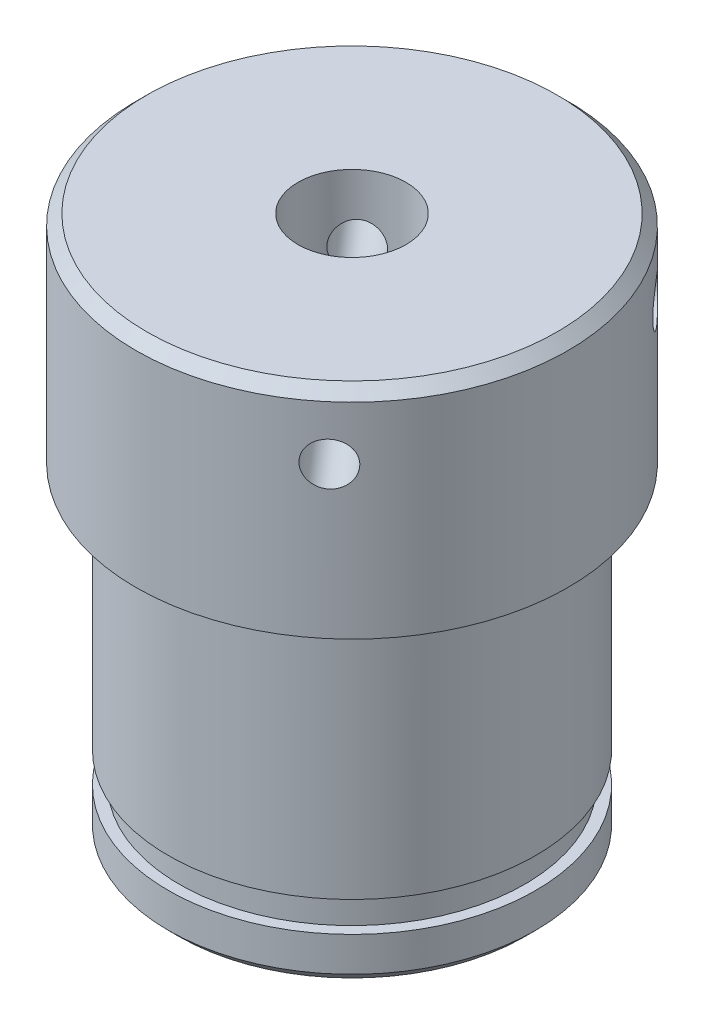
from build123d import *

# Parameters (mm, degrees)
SKETCH_1_R               = 8.5
EXTRUDE_1_DEPTH          = 15
SKETCH_2_R               = 10
EXTRUDE_2_DEPTH          = 10
SKETCH_3_R               = 1
CUT_EXTRUDE_1_DEPTH      = 10
CUT_EXTRUDE_START        = -2.1
SKETCH_4_R               = 8.5
SKETCH_4_R_2             = 8
CUT_EXTRUDE_2_DEPTH      = 1.4
CHAMFER_1_SIZE           = 0.5
SKETCH_7_R               = 1
CUT_EXTRUDE_3_DEPTH      = 8
PATTERN_CIRCULAR_1_COUNT = 4
SKETCH_8_R               = 3.5
CUT_EXTRUDE_4_DEPTH      = 5.5
CHAMFER_2_SIZE           = 0.5
CUT_EXTRUDE_5_REACH      = 26.088
SKETCH_9_R               = 2.5


with BuildPart() as part:
    # Эскиз1 → Бобышка-Вытянуть1 (new body)
    with BuildSketch(Plane(origin=(0, 0, 0), x_dir=(1, 0, 0), z_dir=(0, 1, 0))):
        Circle(SKETCH_1_R)
    extrude(amount=EXTRUDE_1_DEPTH)

    # Эскиз2 → Бобышка-Вытянуть2 (add)
    with BuildSketch(Plane(origin=(0, 15, 0), x_dir=(1, 0, 0), z_dir=(0, 1, 0))):
        Circle(SKETCH_2_R)
    extrude(amount=EXTRUDE_2_DEPTH)

    # Эскиз3 → Вырез-Вытянуть1 (cut)
    with BuildSketch(Plane.XZ):
        with Locations((0, 6)):
            Circle(SKETCH_3_R)
        with Locations((6, 0)):
            Circle(SKETCH_3_R)
        with Locations((0, -6)):
            Circle(SKETCH_3_R)
        with Locations((-6, 0)):
            Circle(SKETCH_3_R)
    extrude(amount=-CUT_EXTRUDE_1_DEPTH, mode=Mode.SUBTRACT)

    # Эскиз4 → Вырез-Вытянуть2 (cut)
    with BuildSketch(Plane.XZ.offset(CUT_EXTRUDE_START)):
        Circle(SKETCH_4_R)
        Circle(SKETCH_4_R_2, mode=Mode.SUBTRACT)
    extrude(amount=-CUT_EXTRUDE_2_DEPTH, mode=Mode.SUBTRACT)

    # Фаска1
    chamfer_1_edges = [part.edges().sort_by_distance(p)[0] for p in [
        (-8.5, 0, 0),
        (-10, 25, 0),
    ]]
    chamfer(chamfer_1_edges, length=CHAMFER_1_SIZE)

    # Эскиз7 → Вырез-Вытянуть3 (cut)
    with BuildSketch(Plane(origin=(6.524591557, 0, 7.578238913), x_dir=(0.7578238912515232, 0, -0.6524591556935956), z_dir=(0.6524591556935956, 0, 0.7578238912515232))):
        with Locations((0, 22)):
            Circle(SKETCH_7_R)
    cut_extrude_3 = extrude(amount=-CUT_EXTRUDE_3_DEPTH, mode=Mode.SUBTRACT)

    # Круговой массив1: Вырез-Вытянуть3 ×4 about axis
    pattern_circular_1_axis = Axis((0, 25, 0), (0, -1, 0))
    for i in range(1, PATTERN_CIRCULAR_1_COUNT):
        add(cut_extrude_3.rotate(pattern_circular_1_axis, i * 360 / PATTERN_CIRCULAR_1_COUNT), mode=Mode.SUBTRACT)

    # Эскиз8 → Вырез-Вытянуть4 (cut)
    with BuildSketch(Plane.XZ):
        Circle(SKETCH_8_R)
    extrude(amount=-CUT_EXTRUDE_4_DEPTH, mode=Mode.SUBTRACT)

    # Фаска2
    chamfer_2_edges = [part.edges().sort_by_distance(p)[0] for p in [
        (-3.5, 0, 0),
    ]]
    chamfer(chamfer_2_edges, length=CHAMFER_2_SIZE)

    # Эскиз9 → Вырез-Вытянуть5 (cut, up to next)
    with BuildSketch(Plane.XZ.offset(-5.5), mode=Mode.PRIVATE) as cut_extrude_5_sk1:
        Circle(SKETCH_9_R)
    cut_extrude_5_tool1 = extrude(cut_extrude_5_sk1.sketch, amount=-CUT_EXTRUDE_5_REACH, mode=Mode.PRIVATE) & part.part
    add(cut_extrude_5_tool1.solids().sort_by_distance((0, 5.5, 0))[0], mode=Mode.SUBTRACT)


solid = part.part
